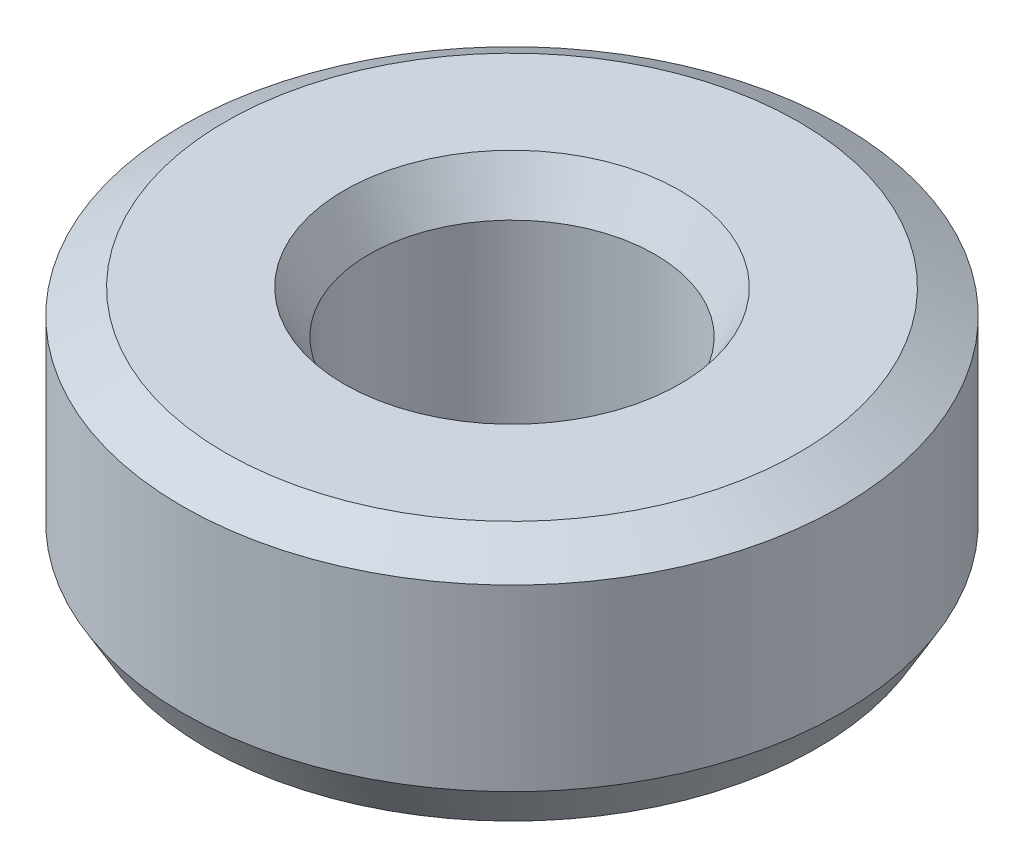
from build123d import *
from OCP.BRepFilletAPI import BRepFilletAPI_MakeChamfer

# Parameters (mm, degrees)
SKETCH1_R           = 37.5
BOSS_EXTRUDE1_DEPTH = 28.066800754
SKETCH2_R           = 16.265425223
CUT_EXTRUDE1_DEPTH  = 61.00204417
CHAMFER1_SIZE       = 2.82298578
CHAMFER1_SIZE2      = 4.8895548


with BuildPart() as part:
    # Sketch1 → Boss-Extrude1 (new body)
    with BuildSketch(Plane(origin=(0, 0, 0), x_dir=(1, 0, 0), z_dir=(0, 1, 0))):
        Circle(SKETCH1_R)
    extrude(amount=BOSS_EXTRUDE1_DEPTH)

    # Sketch2 → Cut-Extrude1 (cut, through all)
    with BuildSketch(Plane(origin=(0, 0, 0), x_dir=(1, 0, 0), z_dir=(0, 1, 0))):
        Circle(SKETCH2_R)
    extrude(amount=CUT_EXTRUDE1_DEPTH, mode=Mode.SUBTRACT)

    # Chamfer1: one chamfer whose edges measure the first distance from different faces: ONE call of the kernel's chamfer builder (chamfer() names one face for all edges)
    chamfer1_edges_1 = [part.edges().sort_by_distance(p)[0] for p in [
        (-16.265425223, 28.066800754, 0),
    ]]
    chamfer1_side_1 = [part.faces().sort_by_distance(p)[0] for p in [
        (-36.439339828, 28.066800754, 0),
    ]]
    chamfer1_edges_2 = [part.edges().sort_by_distance(p)[0] for p in [
        (-16.265425223, 0, 0),
    ]]
    chamfer1_side_2 = [part.faces().sort_by_distance(p)[0] for p in [
        (-16.265425223, 14.033400377, 0),
    ]]
    chamfer1_edges_3 = [part.edges().sort_by_distance(p)[0] for p in [
        (-37.5, 0, 0),
    ]]
    chamfer1_side_3 = [part.faces().sort_by_distance(p)[0] for p in [
        (-36.439339828, 0, 0),
    ]]
    chamfer1_edges_4 = [part.edges().sort_by_distance(p)[0] for p in [
        (-37.5, 28.066800754, 0),
    ]]
    chamfer1_side_4 = [part.faces().sort_by_distance(p)[0] for p in [
        (-37.5, 14.033400377, 0),
    ]]
    chamfer1 = BRepFilletAPI_MakeChamfer(part.part.solid().wrapped)
    for e in chamfer1_edges_1:
        chamfer1.Add(CHAMFER1_SIZE, CHAMFER1_SIZE2, e.wrapped, chamfer1_side_1[0].wrapped)  # the first distance lies on this face
    for e in chamfer1_edges_2:
        chamfer1.Add(CHAMFER1_SIZE, CHAMFER1_SIZE2, e.wrapped, chamfer1_side_2[0].wrapped)  # the first distance lies on this face
    for e in chamfer1_edges_3:
        chamfer1.Add(CHAMFER1_SIZE, CHAMFER1_SIZE2, e.wrapped, chamfer1_side_3[0].wrapped)  # the first distance lies on this face
    for e in chamfer1_edges_4:
        chamfer1.Add(CHAMFER1_SIZE, CHAMFER1_SIZE2, e.wrapped, chamfer1_side_4[0].wrapped)  # the first distance lies on this face
    add(Compound.cast(chamfer1.Shape()), mode=Mode.REPLACE)


solid = part.part
